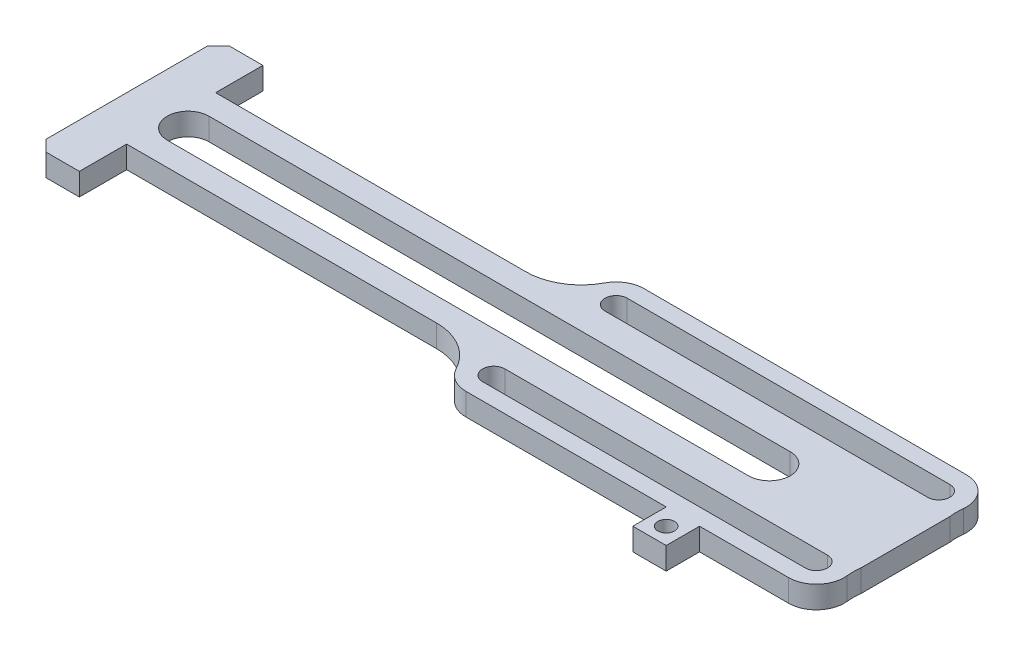
from build123d import *

# Parameters (mm, degrees)
EXTRUDE_1_DEPTH     = 4
EXTRUDE_2_DEPTH     = 4
FILLET_1_R          = 10
CUT_EXTRUDE_1_DEPTH = 142.025706876
SKETCH_4_W          = 6
SKETCH_4_H          = 6
EXTRUDE_7_DEPTH     = 4
SKETCH_6_R          = 1.5
CUT_EXTRUDE_4_DEPTH = 142.774468788


with BuildPart() as part:
    # Эскиз1 → Бобышка-Вытянуть1 (new body)
    with BuildSketch(Plane(origin=(0, 0, 0), x_dir=(1, 0, 0), z_dir=(0, 1, 0))):
        Polygon((-140, -14.5), (-140, 14.5), (-138, 16.5), (-132, 16.5), (-132, 8), (0, 8), (0, -8), (-132, -8), (-132, -16.5), (-138, -16.5), align=None)
    extrude(amount=EXTRUDE_1_DEPTH)

    # Эскиз2 → Бобышка-Вытянуть2 (add)
    # profile 1 of 2: a face of its own
    with BuildSketch(Plane.XZ):
        with BuildLine():
            Line((-63, 16), (-5, 16))
            ThreePointArc((-5, 16), (0, 11), (-5, 6))
            Line((-5, 6), (-63, 6))
            ThreePointArc((-63, 6), (-68, 11), (-63, 16))
        make_face()
        with BuildLine():
            Line((-63, 13), (-5, 13))
            ThreePointArc((-5, 13), (-3, 11), (-5, 9))
            Line((-5, 9), (-63, 9))
            ThreePointArc((-63, 9), (-65, 11), (-63, 13))
        make_face(mode=Mode.SUBTRACT)
    # profile 2 of 2: a face of its own
    with BuildSketch(Plane.XZ):
        with BuildLine():
            Line((-63, -16), (-5, -16))
            ThreePointArc((-5, -16), (0, -11), (-5, -6))
            Line((-5, -6), (-63, -6))
            ThreePointArc((-63, -6), (-68, -11), (-63, -16))
        make_face()
        with BuildLine():
            Line((-63, -13), (-5, -13))
            ThreePointArc((-5, -13), (-3, -11), (-5, -9))
            Line((-5, -9), (-63, -9))
            ThreePointArc((-63, -9), (-65, -11), (-63, -13))
        make_face(mode=Mode.SUBTRACT)
    extrude(amount=-EXTRUDE_2_DEPTH)

    # Скругление1
    # the kernel refuses this fillet: 10 mm, written as the material it adds along each edge
    with BuildSketch(Plane(origin=(-1, 4, 8), x_dir=(1, 0, 0), z_dir=(0, -1, 0))) as fillet_1_piece_1:
        with BuildLine():
            CenterArc((10.90874153, 1.347902551), FILLET_1_R, 173.676623786, 14.069867748)
            Line((0.96958051, 2.44930085), (0.77079729, 2.471328816))
            ThreePointArc((0.77079729, 2.471328816), (0.463030841, 1.233264109), (-0.16, 0.12))
            Line((-0.16, 0.12), (0, -0.2))
            ThreePointArc((0, -0.2), (0.5, -0.2), (0.801825169, -0.026958051))
            Line((0.801825169, -0.026958051), (1, 0))
        make_face()
    extrude(amount=4)
    with BuildSketch(Plane(origin=(-67, 4, 8), x_dir=(-1, 0, 0), z_dir=(0, -1, 0))) as fillet_1_piece_2:
        with BuildLine():
            CenterArc((9.266499161, -10), FILLET_1_R, 90, 62.181860715)
            Line((0.422166387, -5.333333333), (0.245279732, -5.24))
            ThreePointArc((0.245279732, -5.24), (0.785032611, -2.621235013), (-0.16, -0.12))
            Line((-0.16, -0.12), (0, 0.2))
            Line((0, 0.2), (9.266499161, 0.2))
            Line((9.266499161, 0.2), (9.266499161, 0))
        make_face()
    extrude(amount=4)
    with BuildSketch(Plane(origin=(-1, 4, -8), x_dir=(1, 0, 0), z_dir=(0, -1, 0))) as fillet_1_piece_3:
        with BuildLine():
            CenterArc((10.90874153, -1.347902551), FILLET_1_R, 172.253508466, 14.069867748)
            Line((0.96958051, -2.44930085), (0.77079729, -2.471328816))
            ThreePointArc((0.77079729, -2.471328816), (0.463030841, -1.233264109), (-0.16, -0.12))
            Line((-0.16, -0.12), (0, 0.2))
            ThreePointArc((0, 0.2), (0.5, 0.2), (0.801825169, 0.026958051))
            Line((0.801825169, 0.026958051), (1, 0))
        make_face()
    extrude(amount=4)
    with BuildSketch(Plane(origin=(-67, 4, -8), x_dir=(-1, 0, 0), z_dir=(0, -1, 0))) as fillet_1_piece_4:
        with BuildLine():
            CenterArc((9.266499161, 10), FILLET_1_R, 207.818139285, 62.181860715)
            Line((0.422166387, 5.333333333), (0.245279732, 5.24))
            ThreePointArc((0.245279732, 5.24), (0.785032611, 2.621235013), (-0.16, 0.12))
            Line((-0.16, 0.12), (0, -0.2))
            Line((0, -0.2), (9.266499161, -0.2))
            Line((9.266499161, -0.2), (9.266499161, 0))
        make_face()
    extrude(amount=4)

    # Эскиз3 → Вырез-Вытянуть1 (cut, through all)
    with BuildSketch(Plane.XZ):
        with BuildLine():
            Line((-24.447568559, 3.753765504), (-128.9506377, 3.753765504))
            ThreePointArc((-128.9506377, 3.753765504), (-132.7006377, 0.003765504), (-128.9506377, -3.746234496))
            Line((-128.9506377, -3.746234496), (-24.447568559, -3.746234496))
            ThreePointArc((-24.447568559, -3.746234496), (-20.697568559, 0.003765504), (-24.447568559, 3.753765504))
        make_face()
    extrude(amount=-CUT_EXTRUDE_1_DEPTH, mode=Mode.SUBTRACT)

    # Эскиз4 → Бобышка-Вытянуть7 (add)
    with BuildSketch(Plane(origin=(0, 4, 0), x_dir=(1, 0, 0), z_dir=(0, 1, 0))):
        with Locations((-24, -19)):
            Rectangle(SKETCH_4_W, SKETCH_4_H)
    extrude(amount=-EXTRUDE_7_DEPTH)

    # Эскиз6 → Вырез-Вытянуть4 (cut, through all)
    with BuildSketch(Plane(origin=(0, 4, 0), x_dir=(1, 0, 0), z_dir=(0, 1, 0))):
        with Locations(Location((-24, -19, 0), (0, 0, 270))):
            Circle(SKETCH_6_R)
    extrude(amount=-CUT_EXTRUDE_4_DEPTH, mode=Mode.SUBTRACT)


solid = part.part
